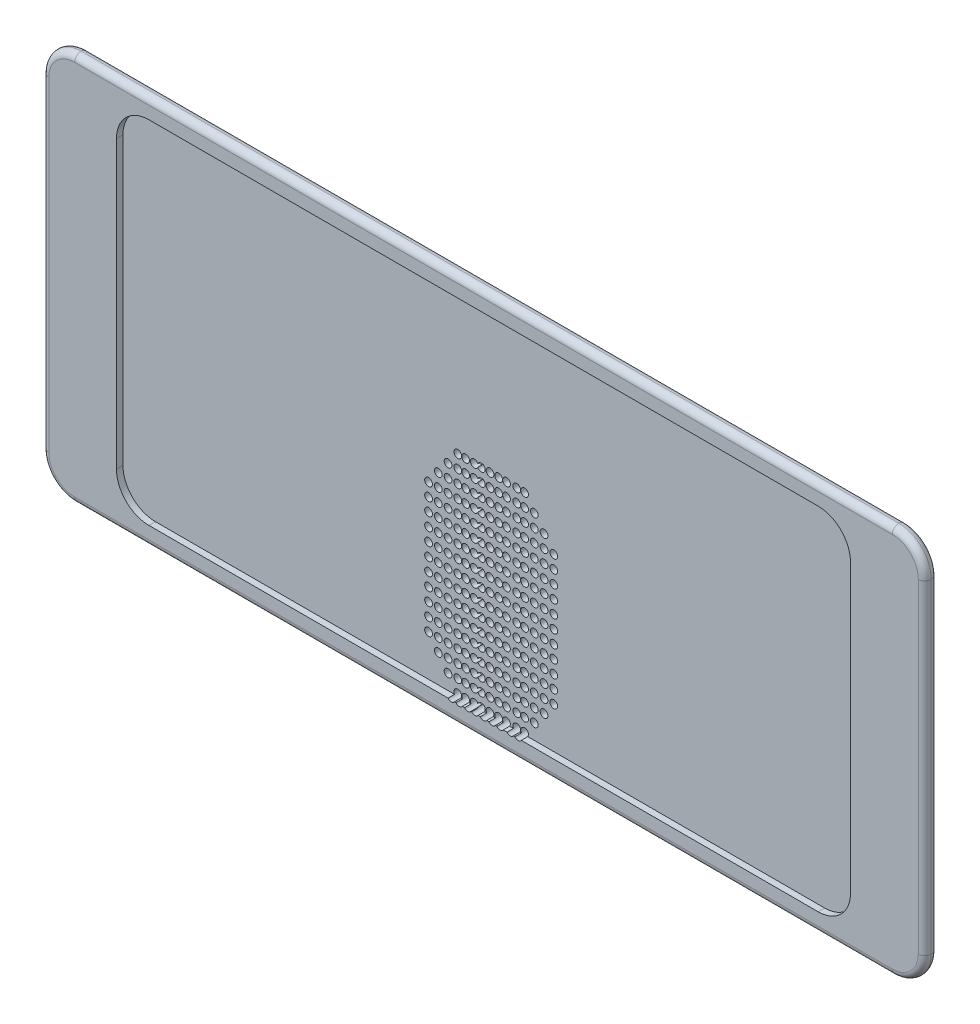
from build123d import *

# Parameters (mm, degrees)
BOSS_EXTRUDE1_DEPTH                     = 2
FILLET4_R                               = 1
CUT_EXTRUDE1_DEPTH                      = 1
F_3_64_0_04688_DIAMETER_HOLE1_OUTLINE_R = 0.595376
F_3_64_0_04688_DIAMETER_HOLE1_DEPTH     = 2


# Read off the part's stored shape, not the designer's step: 3/64 (0.04688) Diameter Hole1
with BuildPart() as part:
    # Sketch2 → Boss-Extrude1 (new body)
    with BuildSketch(Plane.XY):
        with BuildLine():
            Line((-63, -30), (63, -30))
            ThreePointArc((63, -30), (66.535533906, -28.535533906), (68, -25))
            Line((68, -25), (68, 25))
            ThreePointArc((68, 25), (66.535533906, 28.535533906), (63, 30))
            Line((63, 30), (-63, 30))
            ThreePointArc((-63, 30), (-66.535533906, 28.535533906), (-68, 25))
            Line((-68, 25), (-68, -25))
            ThreePointArc((-68, -25), (-66.535533906, -28.535533906), (-63, -30))
        make_face()
    extrude(amount=BOSS_EXTRUDE1_DEPTH)

    # Fillet4
    fillet4_edges = [part.edges().sort_by_distance(p)[0] for p in [
        (66.535533906, 28.535533906, 0),
        (68, 0, 0),
        (66.535533906, -28.535533906, 0),
        (0, -30, 0),
        (-66.535533906, -28.535533906, 0),
        (-68, 0, 0),
        (-66.535533906, 28.535533906, 0),
        (-68, 0, 2),
        (-66.535533906, 28.535533906, 2),
        (66.535533906, 28.535533906, 2),
        (68, 0, 2),
        (66.535533906, -28.535533906, 2),
        (0, -30, 2),
        (-66.535533906, -28.535533906, 2),
        (0, 30, 2),
        (0, 30, 0),
    ]]
    fillet(fillet4_edges, radius=FILLET4_R - 0.0001)  # a hair under: the kernel refuses the full size

    # Sketch4 → Cut-Extrude1 (cut)
    with BuildSketch(Plane.XY.offset(2)):
        with BuildLine():
            Line((-51.561871644, -27.06976084), (51.561871644, -27.06976084))
            ThreePointArc((51.561871644, -27.06976084), (55.09740555, -25.605294746), (56.561871644, -22.06976084))
            Line((56.561871644, -22.06976084), (56.561871644, 22.06976084))
            ThreePointArc((56.561871644, 22.06976084), (55.09740555, 25.605294746), (51.561871644, 27.06976084))
            Line((51.561871644, 27.06976084), (-51.561871644, 27.06976084))
            ThreePointArc((-51.561871644, 27.06976084), (-55.09740555, 25.605294746), (-56.561871644, 22.06976084))
            Line((-56.561871644, 22.06976084), (-56.561871644, -22.06976084))
            ThreePointArc((-56.561871644, -22.06976084), (-55.09740555, -25.605294746), (-51.561871644, -27.06976084))
        make_face()
    extrude(amount=-CUT_EXTRUDE1_DEPTH, mode=Mode.SUBTRACT)

    # 3/64 (0.04688) Diameter Hole1 outline → 3/64 (0.04688) Diameter Hole1 (cut)
    with BuildSketch(Plane.XY):
        with Locations((5.329169919, -26.73138883)):
            Circle(F_3_64_0_04688_DIAMETER_HOLE1_OUTLINE_R)
        with Locations((5.329169919, -24.73138883)):
            Circle(F_3_64_0_04688_DIAMETER_HOLE1_OUTLINE_R)
        with Locations((5.329169919, -22.73138883)):
            Circle(F_3_64_0_04688_DIAMETER_HOLE1_OUTLINE_R)
        with Locations((5.329169919, -20.73138883)):
            Circle(F_3_64_0_04688_DIAMETER_HOLE1_OUTLINE_R)
        with Locations((5.329169919, -18.73138883)):
            Circle(F_3_64_0_04688_DIAMETER_HOLE1_OUTLINE_R)
        with Locations((5.329169919, -16.73138883)):
            Circle(F_3_64_0_04688_DIAMETER_HOLE1_OUTLINE_R)
        with Locations((5.329169919, -14.73138883)):
            Circle(F_3_64_0_04688_DIAMETER_HOLE1_OUTLINE_R)
        with Locations((5.329169919, -12.73138883)):
            Circle(F_3_64_0_04688_DIAMETER_HOLE1_OUTLINE_R)
        with Locations((5.329169919, -10.73138883)):
            Circle(F_3_64_0_04688_DIAMETER_HOLE1_OUTLINE_R)
        with Locations((5.329169919, -8.73138883)):
            Circle(F_3_64_0_04688_DIAMETER_HOLE1_OUTLINE_R)
        with Locations((5.329169919, -6.73138883)):
            Circle(F_3_64_0_04688_DIAMETER_HOLE1_OUTLINE_R)
        with Locations((5.329169919, -4.73138883)):
            Circle(F_3_64_0_04688_DIAMETER_HOLE1_OUTLINE_R)
        with Locations((5.329169919, -2.73138883)):
            Circle(F_3_64_0_04688_DIAMETER_HOLE1_OUTLINE_R)
        with Locations((5.329169919, -0.73138883)):
            Circle(F_3_64_0_04688_DIAMETER_HOLE1_OUTLINE_R)
        with Locations((5.329169919, 1.26861117)):
            Circle(F_3_64_0_04688_DIAMETER_HOLE1_OUTLINE_R)
        with Locations((5.329169919, 3.26861117)):
            Circle(F_3_64_0_04688_DIAMETER_HOLE1_OUTLINE_R)
        with Locations((6.829169919, -24.73138883)):
            Circle(F_3_64_0_04688_DIAMETER_HOLE1_OUTLINE_R)
        with Locations((8.329169919, -22.73138883)):
            Circle(F_3_64_0_04688_DIAMETER_HOLE1_OUTLINE_R)
        with Locations((6.829169919, -22.73138883)):
            Circle(F_3_64_0_04688_DIAMETER_HOLE1_OUTLINE_R)
        with Locations((9.829169919, -20.73138883)):
            Circle(F_3_64_0_04688_DIAMETER_HOLE1_OUTLINE_R)
        with Locations((8.329169919, -20.73138883)):
            Circle(F_3_64_0_04688_DIAMETER_HOLE1_OUTLINE_R)
        with Locations((6.829169919, -20.73138883)):
            Circle(F_3_64_0_04688_DIAMETER_HOLE1_OUTLINE_R)
        with Locations((9.829169919, -18.73138883)):
            Circle(F_3_64_0_04688_DIAMETER_HOLE1_OUTLINE_R)
        with Locations((8.329169919, -18.73138883)):
            Circle(F_3_64_0_04688_DIAMETER_HOLE1_OUTLINE_R)
        with Locations((6.829169919, -18.73138883)):
            Circle(F_3_64_0_04688_DIAMETER_HOLE1_OUTLINE_R)
        with Locations((9.829169919, -16.73138883)):
            Circle(F_3_64_0_04688_DIAMETER_HOLE1_OUTLINE_R)
        with Locations((8.329169919, -16.73138883)):
            Circle(F_3_64_0_04688_DIAMETER_HOLE1_OUTLINE_R)
        with Locations((6.829169919, -16.73138883)):
            Circle(F_3_64_0_04688_DIAMETER_HOLE1_OUTLINE_R)
        with Locations((9.829169919, -14.73138883)):
            Circle(F_3_64_0_04688_DIAMETER_HOLE1_OUTLINE_R)
        with Locations((8.329169919, -14.73138883)):
            Circle(F_3_64_0_04688_DIAMETER_HOLE1_OUTLINE_R)
        with Locations((6.829169919, -14.73138883)):
            Circle(F_3_64_0_04688_DIAMETER_HOLE1_OUTLINE_R)
        with Locations((9.829169919, -12.73138883)):
            Circle(F_3_64_0_04688_DIAMETER_HOLE1_OUTLINE_R)
        with Locations((8.329169919, -12.73138883)):
            Circle(F_3_64_0_04688_DIAMETER_HOLE1_OUTLINE_R)
        with Locations((6.829169919, -12.73138883)):
            Circle(F_3_64_0_04688_DIAMETER_HOLE1_OUTLINE_R)
        with Locations((9.829169919, -10.73138883)):
            Circle(F_3_64_0_04688_DIAMETER_HOLE1_OUTLINE_R)
        with Locations((8.329169919, -10.73138883)):
            Circle(F_3_64_0_04688_DIAMETER_HOLE1_OUTLINE_R)
        with Locations((6.829169919, -10.73138883)):
            Circle(F_3_64_0_04688_DIAMETER_HOLE1_OUTLINE_R)
        with Locations((9.829169919, -8.73138883)):
            Circle(F_3_64_0_04688_DIAMETER_HOLE1_OUTLINE_R)
        with Locations((8.329169919, -8.73138883)):
            Circle(F_3_64_0_04688_DIAMETER_HOLE1_OUTLINE_R)
        with Locations((6.829169919, -8.73138883)):
            Circle(F_3_64_0_04688_DIAMETER_HOLE1_OUTLINE_R)
        with Locations((9.829169919, -6.73138883)):
            Circle(F_3_64_0_04688_DIAMETER_HOLE1_OUTLINE_R)
        with Locations((8.329169919, -6.73138883)):
            Circle(F_3_64_0_04688_DIAMETER_HOLE1_OUTLINE_R)
        with Locations((6.829169919, -6.73138883)):
            Circle(F_3_64_0_04688_DIAMETER_HOLE1_OUTLINE_R)
        with Locations((9.829169919, -4.73138883)):
            Circle(F_3_64_0_04688_DIAMETER_HOLE1_OUTLINE_R)
        with Locations((8.329169919, -4.73138883)):
            Circle(F_3_64_0_04688_DIAMETER_HOLE1_OUTLINE_R)
        with Locations((6.829169919, -4.73138883)):
            Circle(F_3_64_0_04688_DIAMETER_HOLE1_OUTLINE_R)
        with Locations((9.829169919, -2.73138883)):
            Circle(F_3_64_0_04688_DIAMETER_HOLE1_OUTLINE_R)
        with Locations((8.329169919, -2.73138883)):
            Circle(F_3_64_0_04688_DIAMETER_HOLE1_OUTLINE_R)
        with Locations((6.829169919, -2.73138883)):
            Circle(F_3_64_0_04688_DIAMETER_HOLE1_OUTLINE_R)
        with Locations((9.829169919, -0.73138883)):
            Circle(F_3_64_0_04688_DIAMETER_HOLE1_OUTLINE_R)
        with Locations((8.329169919, -0.73138883)):
            Circle(F_3_64_0_04688_DIAMETER_HOLE1_OUTLINE_R)
        with Locations((6.829169919, -0.73138883)):
            Circle(F_3_64_0_04688_DIAMETER_HOLE1_OUTLINE_R)
        with Locations((8.329169919, 1.26861117)):
            Circle(F_3_64_0_04688_DIAMETER_HOLE1_OUTLINE_R)
        with Locations((6.829169919, 1.26861117)):
            Circle(F_3_64_0_04688_DIAMETER_HOLE1_OUTLINE_R)
        with Locations((6.829169919, 3.26861117)):
            Circle(F_3_64_0_04688_DIAMETER_HOLE1_OUTLINE_R)
        with Locations((-4.965817425, -26.73138883)):
            Circle(F_3_64_0_04688_DIAMETER_HOLE1_OUTLINE_R)
        with Locations((-4.965817425, -24.73138883)):
            Circle(F_3_64_0_04688_DIAMETER_HOLE1_OUTLINE_R)
        with Locations((-4.965817425, -22.73138883)):
            Circle(F_3_64_0_04688_DIAMETER_HOLE1_OUTLINE_R)
        with Locations((-4.965817425, -20.73138883)):
            Circle(F_3_64_0_04688_DIAMETER_HOLE1_OUTLINE_R)
        with Locations((-4.965817425, -18.73138883)):
            Circle(F_3_64_0_04688_DIAMETER_HOLE1_OUTLINE_R)
        with Locations((-4.965817425, -16.73138883)):
            Circle(F_3_64_0_04688_DIAMETER_HOLE1_OUTLINE_R)
        with Locations((-4.965817425, -14.73138883)):
            Circle(F_3_64_0_04688_DIAMETER_HOLE1_OUTLINE_R)
        with Locations((-4.965817425, -12.73138883)):
            Circle(F_3_64_0_04688_DIAMETER_HOLE1_OUTLINE_R)
        with Locations((-4.965817425, -10.73138883)):
            Circle(F_3_64_0_04688_DIAMETER_HOLE1_OUTLINE_R)
        with Locations((-4.965817425, -8.73138883)):
            Circle(F_3_64_0_04688_DIAMETER_HOLE1_OUTLINE_R)
        with Locations((-4.965817425, -6.73138883)):
            Circle(F_3_64_0_04688_DIAMETER_HOLE1_OUTLINE_R)
        with Locations((-4.965817425, -4.73138883)):
            Circle(F_3_64_0_04688_DIAMETER_HOLE1_OUTLINE_R)
        with Locations((-4.965817425, -2.73138883)):
            Circle(F_3_64_0_04688_DIAMETER_HOLE1_OUTLINE_R)
        with Locations((-4.965817425, -0.73138883)):
            Circle(F_3_64_0_04688_DIAMETER_HOLE1_OUTLINE_R)
        with Locations((-4.965817425, 1.26861117)):
            Circle(F_3_64_0_04688_DIAMETER_HOLE1_OUTLINE_R)
        with Locations((-4.965817425, 3.26861117)):
            Circle(F_3_64_0_04688_DIAMETER_HOLE1_OUTLINE_R)
        with Locations((-6.465817425, -24.73138883)):
            Circle(F_3_64_0_04688_DIAMETER_HOLE1_OUTLINE_R)
        with Locations((-7.965817425, -22.73138883)):
            Circle(F_3_64_0_04688_DIAMETER_HOLE1_OUTLINE_R)
        with Locations((-6.465817425, -22.73138883)):
            Circle(F_3_64_0_04688_DIAMETER_HOLE1_OUTLINE_R)
        with Locations((-9.465817425, -20.73138883)):
            Circle(F_3_64_0_04688_DIAMETER_HOLE1_OUTLINE_R)
        with Locations((-7.965817425, -20.73138883)):
            Circle(F_3_64_0_04688_DIAMETER_HOLE1_OUTLINE_R)
        with Locations((-6.465817425, -20.73138883)):
            Circle(F_3_64_0_04688_DIAMETER_HOLE1_OUTLINE_R)
        with Locations((-9.465817425, -18.73138883)):
            Circle(F_3_64_0_04688_DIAMETER_HOLE1_OUTLINE_R)
        with Locations((-7.965817425, -18.73138883)):
            Circle(F_3_64_0_04688_DIAMETER_HOLE1_OUTLINE_R)
        with Locations((-6.465817425, -18.73138883)):
            Circle(F_3_64_0_04688_DIAMETER_HOLE1_OUTLINE_R)
        with Locations((-9.465817425, -16.73138883)):
            Circle(F_3_64_0_04688_DIAMETER_HOLE1_OUTLINE_R)
        with Locations((-7.965817425, -16.73138883)):
            Circle(F_3_64_0_04688_DIAMETER_HOLE1_OUTLINE_R)
        with Locations((-6.465817425, -16.73138883)):
            Circle(F_3_64_0_04688_DIAMETER_HOLE1_OUTLINE_R)
        with Locations((-9.465817425, -14.73138883)):
            Circle(F_3_64_0_04688_DIAMETER_HOLE1_OUTLINE_R)
        with Locations((-7.965817425, -14.73138883)):
            Circle(F_3_64_0_04688_DIAMETER_HOLE1_OUTLINE_R)
        with Locations((-6.465817425, -14.73138883)):
            Circle(F_3_64_0_04688_DIAMETER_HOLE1_OUTLINE_R)
        with Locations((-9.465817425, -12.73138883)):
            Circle(F_3_64_0_04688_DIAMETER_HOLE1_OUTLINE_R)
        with Locations((-7.965817425, -12.73138883)):
            Circle(F_3_64_0_04688_DIAMETER_HOLE1_OUTLINE_R)
        with Locations((-6.465817425, -12.73138883)):
            Circle(F_3_64_0_04688_DIAMETER_HOLE1_OUTLINE_R)
        with Locations((-9.465817425, -10.73138883)):
            Circle(F_3_64_0_04688_DIAMETER_HOLE1_OUTLINE_R)
        with Locations((-7.965817425, -10.73138883)):
            Circle(F_3_64_0_04688_DIAMETER_HOLE1_OUTLINE_R)
        with Locations((-6.465817425, -10.73138883)):
            Circle(F_3_64_0_04688_DIAMETER_HOLE1_OUTLINE_R)
        with Locations((-9.465817425, -8.73138883)):
            Circle(F_3_64_0_04688_DIAMETER_HOLE1_OUTLINE_R)
        with Locations((-7.965817425, -8.73138883)):
            Circle(F_3_64_0_04688_DIAMETER_HOLE1_OUTLINE_R)
        with Locations((-6.465817425, -8.73138883)):
            Circle(F_3_64_0_04688_DIAMETER_HOLE1_OUTLINE_R)
        with Locations((-9.465817425, -6.73138883)):
            Circle(F_3_64_0_04688_DIAMETER_HOLE1_OUTLINE_R)
        with Locations((-7.965817425, -6.73138883)):
            Circle(F_3_64_0_04688_DIAMETER_HOLE1_OUTLINE_R)
        with Locations((-6.465817425, -6.73138883)):
            Circle(F_3_64_0_04688_DIAMETER_HOLE1_OUTLINE_R)
        with Locations((-9.465817425, -4.73138883)):
            Circle(F_3_64_0_04688_DIAMETER_HOLE1_OUTLINE_R)
        with Locations((-7.965817425, -4.73138883)):
            Circle(F_3_64_0_04688_DIAMETER_HOLE1_OUTLINE_R)
        with Locations((-6.465817425, -4.73138883)):
            Circle(F_3_64_0_04688_DIAMETER_HOLE1_OUTLINE_R)
        with Locations((-9.465817425, -2.73138883)):
            Circle(F_3_64_0_04688_DIAMETER_HOLE1_OUTLINE_R)
        with Locations((-7.965817425, -2.73138883)):
            Circle(F_3_64_0_04688_DIAMETER_HOLE1_OUTLINE_R)
        with Locations((-6.465817425, -2.73138883)):
            Circle(F_3_64_0_04688_DIAMETER_HOLE1_OUTLINE_R)
        with Locations((-9.465817425, -0.73138883)):
            Circle(F_3_64_0_04688_DIAMETER_HOLE1_OUTLINE_R)
        with Locations((-7.965817425, -0.73138883)):
            Circle(F_3_64_0_04688_DIAMETER_HOLE1_OUTLINE_R)
        with Locations((-6.465817425, -0.73138883)):
            Circle(F_3_64_0_04688_DIAMETER_HOLE1_OUTLINE_R)
        with Locations((-7.965817425, 1.26861117)):
            Circle(F_3_64_0_04688_DIAMETER_HOLE1_OUTLINE_R)
        with Locations((-6.465817425, 1.26861117)):
            Circle(F_3_64_0_04688_DIAMETER_HOLE1_OUTLINE_R)
        with Locations((-6.465817425, 3.26861117)):
            Circle(F_3_64_0_04688_DIAMETER_HOLE1_OUTLINE_R)
        with Locations((-3.754642443, -26.73138883)):
            Circle(F_3_64_0_04688_DIAMETER_HOLE1_OUTLINE_R)
        with BuildLine():
            ThreePointArc((-1.877321222, -26.491771944), (-3.017725963, -26.73138883), (-1.877321222, -26.971005716))
            ThreePointArc((-1.877321222, -26.971005716), (-0.73691648, -26.73138883), (-1.877321222, -26.491771944))
        make_face()
        with Locations((4.117994938, -26.73138883)):
            Circle(F_3_64_0_04688_DIAMETER_HOLE1_OUTLINE_R)
        with Locations((2.543467461, -26.73138883)):
            Circle(F_3_64_0_04688_DIAMETER_HOLE1_OUTLINE_R)
        with Locations((1.33229248, -26.73138883)):
            Circle(F_3_64_0_04688_DIAMETER_HOLE1_OUTLINE_R)
        with Locations((0, -26.73138883)):
            Circle(F_3_64_0_04688_DIAMETER_HOLE1_OUTLINE_R)
        with Locations((-3.754642443, -24.73138883)):
            Circle(F_3_64_0_04688_DIAMETER_HOLE1_OUTLINE_R)
        with BuildLine():
            ThreePointArc((-1.877321222, -24.491771944), (-3.017725963, -24.73138883), (-1.877321222, -24.971005716))
            ThreePointArc((-1.877321222, -24.971005716), (-0.73691648, -24.73138883), (-1.877321222, -24.491771944))
        make_face()
        with Locations((4.117994938, -24.73138883)):
            Circle(F_3_64_0_04688_DIAMETER_HOLE1_OUTLINE_R)
        with Locations((2.543467461, -24.73138883)):
            Circle(F_3_64_0_04688_DIAMETER_HOLE1_OUTLINE_R)
        with Locations((1.33229248, -24.73138883)):
            Circle(F_3_64_0_04688_DIAMETER_HOLE1_OUTLINE_R)
        with Locations((0, -24.73138883)):
            Circle(F_3_64_0_04688_DIAMETER_HOLE1_OUTLINE_R)
        with Locations((-3.754642443, -22.73138883)):
            Circle(F_3_64_0_04688_DIAMETER_HOLE1_OUTLINE_R)
        with BuildLine():
            ThreePointArc((-1.877321222, -22.491771944), (-3.017725963, -22.73138883), (-1.877321222, -22.971005716))
            ThreePointArc((-1.877321222, -22.971005716), (-0.73691648, -22.73138883), (-1.877321222, -22.491771944))
        make_face()
        with Locations((4.117994938, -22.73138883)):
            Circle(F_3_64_0_04688_DIAMETER_HOLE1_OUTLINE_R)
        with Locations((2.543467461, -22.73138883)):
            Circle(F_3_64_0_04688_DIAMETER_HOLE1_OUTLINE_R)
        with Locations((1.33229248, -22.73138883)):
            Circle(F_3_64_0_04688_DIAMETER_HOLE1_OUTLINE_R)
        with Locations((0, -22.73138883)):
            Circle(F_3_64_0_04688_DIAMETER_HOLE1_OUTLINE_R)
        with Locations((-3.754642443, -20.73138883)):
            Circle(F_3_64_0_04688_DIAMETER_HOLE1_OUTLINE_R)
        with BuildLine():
            ThreePointArc((-1.877321222, -20.491771944), (-3.017725963, -20.73138883), (-1.877321222, -20.971005716))
            ThreePointArc((-1.877321222, -20.971005716), (-0.73691648, -20.73138883), (-1.877321222, -20.491771944))
        make_face()
        with Locations((4.117994938, -20.73138883)):
            Circle(F_3_64_0_04688_DIAMETER_HOLE1_OUTLINE_R)
        with Locations((2.543467461, -20.73138883)):
            Circle(F_3_64_0_04688_DIAMETER_HOLE1_OUTLINE_R)
        with Locations((1.33229248, -20.73138883)):
            Circle(F_3_64_0_04688_DIAMETER_HOLE1_OUTLINE_R)
        with Locations((0, -20.73138883)):
            Circle(F_3_64_0_04688_DIAMETER_HOLE1_OUTLINE_R)
        with Locations((-3.754642443, -18.73138883)):
            Circle(F_3_64_0_04688_DIAMETER_HOLE1_OUTLINE_R)
        with BuildLine():
            ThreePointArc((-1.877321222, -18.491771944), (-3.017725963, -18.73138883), (-1.877321222, -18.971005716))
            ThreePointArc((-1.877321222, -18.971005716), (-0.73691648, -18.73138883), (-1.877321222, -18.491771944))
        make_face()
        with Locations((4.117994938, -18.73138883)):
            Circle(F_3_64_0_04688_DIAMETER_HOLE1_OUTLINE_R)
        with Locations((2.543467461, -18.73138883)):
            Circle(F_3_64_0_04688_DIAMETER_HOLE1_OUTLINE_R)
        with Locations((1.33229248, -18.73138883)):
            Circle(F_3_64_0_04688_DIAMETER_HOLE1_OUTLINE_R)
        with Locations((0, -18.73138883)):
            Circle(F_3_64_0_04688_DIAMETER_HOLE1_OUTLINE_R)
        with Locations((-3.754642443, -16.73138883)):
            Circle(F_3_64_0_04688_DIAMETER_HOLE1_OUTLINE_R)
        with BuildLine():
            ThreePointArc((-1.877321222, -16.491771944), (-3.017725963, -16.73138883), (-1.877321222, -16.971005716))
            ThreePointArc((-1.877321222, -16.971005716), (-0.73691648, -16.73138883), (-1.877321222, -16.491771944))
        make_face()
        with Locations((4.117994938, -16.73138883)):
            Circle(F_3_64_0_04688_DIAMETER_HOLE1_OUTLINE_R)
        with Locations((2.543467461, -16.73138883)):
            Circle(F_3_64_0_04688_DIAMETER_HOLE1_OUTLINE_R)
        with Locations((1.33229248, -16.73138883)):
            Circle(F_3_64_0_04688_DIAMETER_HOLE1_OUTLINE_R)
        with Locations((0, -16.73138883)):
            Circle(F_3_64_0_04688_DIAMETER_HOLE1_OUTLINE_R)
        with Locations((-3.754642443, -14.73138883)):
            Circle(F_3_64_0_04688_DIAMETER_HOLE1_OUTLINE_R)
        with BuildLine():
            ThreePointArc((-1.877321222, -14.491771944), (-3.017725963, -14.73138883), (-1.877321222, -14.971005716))
            ThreePointArc((-1.877321222, -14.971005716), (-0.73691648, -14.73138883), (-1.877321222, -14.491771944))
        make_face()
        with Locations((4.117994938, -14.73138883)):
            Circle(F_3_64_0_04688_DIAMETER_HOLE1_OUTLINE_R)
        with Locations((2.543467461, -14.73138883)):
            Circle(F_3_64_0_04688_DIAMETER_HOLE1_OUTLINE_R)
        with Locations((1.33229248, -14.73138883)):
            Circle(F_3_64_0_04688_DIAMETER_HOLE1_OUTLINE_R)
        with Locations((0, -14.73138883)):
            Circle(F_3_64_0_04688_DIAMETER_HOLE1_OUTLINE_R)
        with Locations((-3.754642443, -12.73138883)):
            Circle(F_3_64_0_04688_DIAMETER_HOLE1_OUTLINE_R)
        with BuildLine():
            ThreePointArc((-1.877321222, -12.491771944), (-3.017725963, -12.73138883), (-1.877321222, -12.971005716))
            ThreePointArc((-1.877321222, -12.971005716), (-0.73691648, -12.73138883), (-1.877321222, -12.491771944))
        make_face()
        with Locations((4.117994938, -12.73138883)):
            Circle(F_3_64_0_04688_DIAMETER_HOLE1_OUTLINE_R)
        with Locations((2.543467461, -12.73138883)):
            Circle(F_3_64_0_04688_DIAMETER_HOLE1_OUTLINE_R)
        with Locations((1.33229248, -12.73138883)):
            Circle(F_3_64_0_04688_DIAMETER_HOLE1_OUTLINE_R)
        with Locations((0, -12.73138883)):
            Circle(F_3_64_0_04688_DIAMETER_HOLE1_OUTLINE_R)
        with Locations((-3.754642443, -10.73138883)):
            Circle(F_3_64_0_04688_DIAMETER_HOLE1_OUTLINE_R)
        with BuildLine():
            ThreePointArc((-1.877321222, -10.491771944), (-3.017725963, -10.73138883), (-1.877321222, -10.971005716))
            ThreePointArc((-1.877321222, -10.971005716), (-0.73691648, -10.73138883), (-1.877321222, -10.491771944))
        make_face()
        with Locations((4.117994938, -10.73138883)):
            Circle(F_3_64_0_04688_DIAMETER_HOLE1_OUTLINE_R)
        with Locations((2.543467461, -10.73138883)):
            Circle(F_3_64_0_04688_DIAMETER_HOLE1_OUTLINE_R)
        with Locations((1.33229248, -10.73138883)):
            Circle(F_3_64_0_04688_DIAMETER_HOLE1_OUTLINE_R)
        with Locations((0, -10.73138883)):
            Circle(F_3_64_0_04688_DIAMETER_HOLE1_OUTLINE_R)
        with Locations((-3.754642443, -8.73138883)):
            Circle(F_3_64_0_04688_DIAMETER_HOLE1_OUTLINE_R)
        with BuildLine():
            ThreePointArc((-1.877321222, -8.491771944), (-3.017725963, -8.73138883), (-1.877321222, -8.971005716))
            ThreePointArc((-1.877321222, -8.971005716), (-0.73691648, -8.73138883), (-1.877321222, -8.491771944))
        make_face()
        with Locations((4.117994938, -8.73138883)):
            Circle(F_3_64_0_04688_DIAMETER_HOLE1_OUTLINE_R)
        with Locations((2.543467461, -8.73138883)):
            Circle(F_3_64_0_04688_DIAMETER_HOLE1_OUTLINE_R)
        with Locations((1.33229248, -8.73138883)):
            Circle(F_3_64_0_04688_DIAMETER_HOLE1_OUTLINE_R)
        with Locations((0, -8.73138883)):
            Circle(F_3_64_0_04688_DIAMETER_HOLE1_OUTLINE_R)
        with Locations((-3.754642443, -6.73138883)):
            Circle(F_3_64_0_04688_DIAMETER_HOLE1_OUTLINE_R)
        with BuildLine():
            ThreePointArc((-1.877321222, -6.491771944), (-3.017725963, -6.73138883), (-1.877321222, -6.971005716))
            ThreePointArc((-1.877321222, -6.971005716), (-0.73691648, -6.73138883), (-1.877321222, -6.491771944))
        make_face()
        with Locations((4.117994938, -6.73138883)):
            Circle(F_3_64_0_04688_DIAMETER_HOLE1_OUTLINE_R)
        with Locations((2.543467462, -6.73138883)):
            Circle(F_3_64_0_04688_DIAMETER_HOLE1_OUTLINE_R)
        with Locations((1.33229248, -6.73138883)):
            Circle(F_3_64_0_04688_DIAMETER_HOLE1_OUTLINE_R)
        with Locations((0, -6.73138883)):
            Circle(F_3_64_0_04688_DIAMETER_HOLE1_OUTLINE_R)
        with Locations((-3.754642443, -4.73138883)):
            Circle(F_3_64_0_04688_DIAMETER_HOLE1_OUTLINE_R)
        with BuildLine():
            ThreePointArc((-1.877321222, -4.491771944), (-3.017725963, -4.73138883), (-1.877321222, -4.971005716))
            ThreePointArc((-1.877321222, -4.971005716), (-0.73691648, -4.73138883), (-1.877321222, -4.491771944))
        make_face()
        with Locations((4.117994938, -4.73138883)):
            Circle(F_3_64_0_04688_DIAMETER_HOLE1_OUTLINE_R)
        with Locations((2.543467462, -4.73138883)):
            Circle(F_3_64_0_04688_DIAMETER_HOLE1_OUTLINE_R)
        with Locations((1.33229248, -4.73138883)):
            Circle(F_3_64_0_04688_DIAMETER_HOLE1_OUTLINE_R)
        with Locations((0, -4.73138883)):
            Circle(F_3_64_0_04688_DIAMETER_HOLE1_OUTLINE_R)
        with Locations((-3.754642443, -2.73138883)):
            Circle(F_3_64_0_04688_DIAMETER_HOLE1_OUTLINE_R)
        with BuildLine():
            ThreePointArc((-1.877321222, -2.491771944), (-3.017725963, -2.73138883), (-1.877321222, -2.971005716))
            ThreePointArc((-1.877321222, -2.971005716), (-0.73691648, -2.73138883), (-1.877321222, -2.491771944))
        make_face()
        with Locations((4.117994938, -2.73138883)):
            Circle(F_3_64_0_04688_DIAMETER_HOLE1_OUTLINE_R)
        with Locations((2.543467462, -2.73138883)):
            Circle(F_3_64_0_04688_DIAMETER_HOLE1_OUTLINE_R)
        with Locations((1.33229248, -2.73138883)):
            Circle(F_3_64_0_04688_DIAMETER_HOLE1_OUTLINE_R)
        with Locations((0, -2.73138883)):
            Circle(F_3_64_0_04688_DIAMETER_HOLE1_OUTLINE_R)
        with Locations((-3.754642443, -0.73138883)):
            Circle(F_3_64_0_04688_DIAMETER_HOLE1_OUTLINE_R)
        with BuildLine():
            ThreePointArc((-1.877321222, -0.491771944), (-3.017725963, -0.73138883), (-1.877321222, -0.971005716))
            ThreePointArc((-1.877321222, -0.971005716), (-0.73691648, -0.73138883), (-1.877321222, -0.491771944))
        make_face()
        with Locations((4.117994938, -0.73138883)):
            Circle(F_3_64_0_04688_DIAMETER_HOLE1_OUTLINE_R)
        with Locations((2.543467462, -0.73138883)):
            Circle(F_3_64_0_04688_DIAMETER_HOLE1_OUTLINE_R)
        with Locations((1.33229248, -0.73138883)):
            Circle(F_3_64_0_04688_DIAMETER_HOLE1_OUTLINE_R)
        with Locations((0, -0.73138883)):
            Circle(F_3_64_0_04688_DIAMETER_HOLE1_OUTLINE_R)
        with Locations((-3.754642443, 1.26861117)):
            Circle(F_3_64_0_04688_DIAMETER_HOLE1_OUTLINE_R)
        with BuildLine():
            ThreePointArc((-1.877321222, 1.508228056), (-3.017725963, 1.26861117), (-1.877321222, 1.028994284))
            ThreePointArc((-1.877321222, 1.028994284), (-0.73691648, 1.26861117), (-1.877321222, 1.508228056))
        make_face()
        with Locations((4.117994938, 1.26861117)):
            Circle(F_3_64_0_04688_DIAMETER_HOLE1_OUTLINE_R)
        with Locations((2.543467462, 1.26861117)):
            Circle(F_3_64_0_04688_DIAMETER_HOLE1_OUTLINE_R)
        with Locations((1.33229248, 1.26861117)):
            Circle(F_3_64_0_04688_DIAMETER_HOLE1_OUTLINE_R)
        with Locations((0, 1.26861117)):
            Circle(F_3_64_0_04688_DIAMETER_HOLE1_OUTLINE_R)
        with Locations((-3.754642443, 3.26861117)):
            Circle(F_3_64_0_04688_DIAMETER_HOLE1_OUTLINE_R)
        with BuildLine():
            ThreePointArc((-1.877321222, 3.508228056), (-3.017725963, 3.26861117), (-1.877321222, 3.028994284))
            ThreePointArc((-1.877321222, 3.028994284), (-0.73691648, 3.26861117), (-1.877321222, 3.508228056))
        make_face()
        with Locations((4.117994938, 3.26861117)):
            Circle(F_3_64_0_04688_DIAMETER_HOLE1_OUTLINE_R)
        with Locations((2.543467462, 3.26861117)):
            Circle(F_3_64_0_04688_DIAMETER_HOLE1_OUTLINE_R)
        with Locations((1.33229248, 3.26861117)):
            Circle(F_3_64_0_04688_DIAMETER_HOLE1_OUTLINE_R)
        with Locations((0, 3.26861117)):
            Circle(F_3_64_0_04688_DIAMETER_HOLE1_OUTLINE_R)
        with Locations((-4.965817425, 5.26861117)):
            Circle(F_3_64_0_04688_DIAMETER_HOLE1_OUTLINE_R)
        with Locations((-3.754642443, 5.26861117)):
            Circle(F_3_64_0_04688_DIAMETER_HOLE1_OUTLINE_R)
        with BuildLine():
            ThreePointArc((-1.877321222, 5.508228056), (-3.017725963, 5.26861117), (-1.877321222, 5.028994284))
            ThreePointArc((-1.877321222, 5.028994284), (-0.73691648, 5.26861117), (-1.877321222, 5.508228056))
        make_face()
        with Locations((5.329169919, 5.26861117)):
            Circle(F_3_64_0_04688_DIAMETER_HOLE1_OUTLINE_R)
        with Locations((4.117994938, 5.26861117)):
            Circle(F_3_64_0_04688_DIAMETER_HOLE1_OUTLINE_R)
        with Locations((2.543467462, 5.26861117)):
            Circle(F_3_64_0_04688_DIAMETER_HOLE1_OUTLINE_R)
        with Locations((1.33229248, 5.26861117)):
            Circle(F_3_64_0_04688_DIAMETER_HOLE1_OUTLINE_R)
        with Locations((0, 5.26861117)):
            Circle(F_3_64_0_04688_DIAMETER_HOLE1_OUTLINE_R)
    extrude(amount=F_3_64_0_04688_DIAMETER_HOLE1_DEPTH, mode=Mode.SUBTRACT)


solid = part.part
